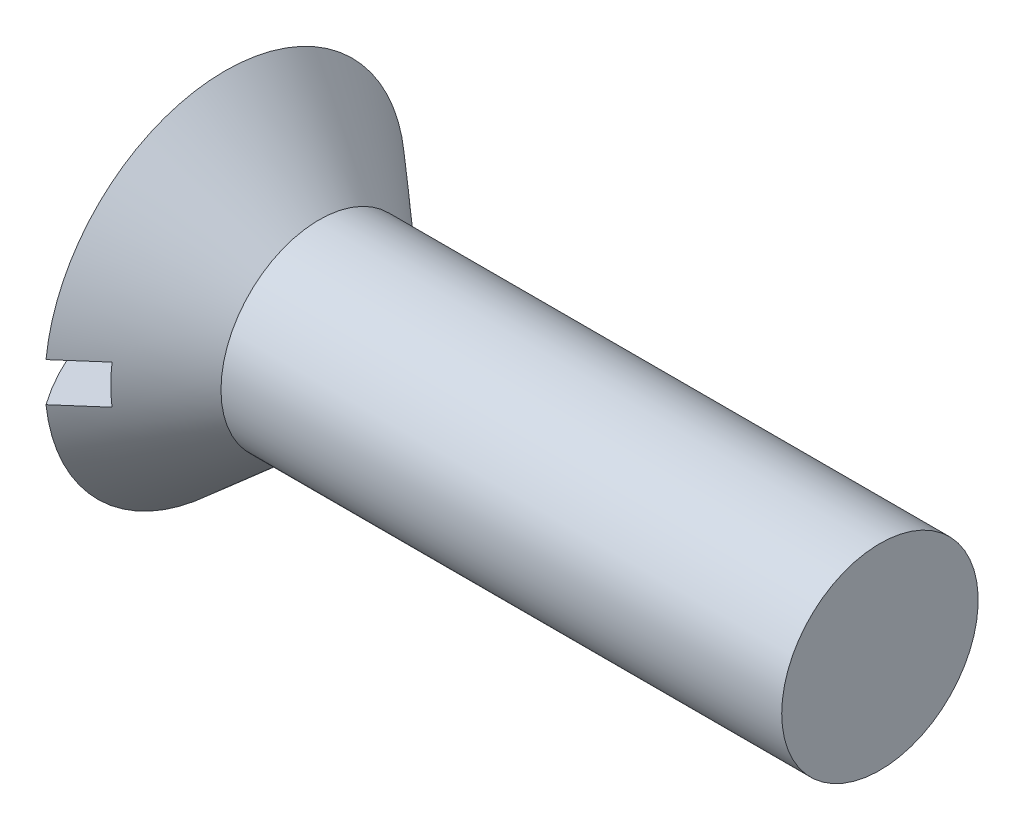
from build123d import *

# Parameters (mm, degrees)
SKETCH2_W         = 34.925
SKETCH2_H         = 3.7846
SLOT_DEPTH        = 8.9662
CIRPATTERN1_COUNT = 2
CIRPATTERN1_ANGLE = 90


with BuildPart() as part:
    # BodySke → Base-Revolve (revolve)
    with BuildSketch(Plane.XY):
        with BuildLine():
            Line((0, 0), (69.050150768, 0))
            Line((69.050150768, 0), (69.050150768, 9.525))
            Line((69.050150768, 9.525), (14.6812, 9.525))
            Line((14.6812, 9.525), (5.550150768, 17.4625))
            ThreePointArc((5.550150768, 17.4625), (1.420913597, 9.161646683), (0, 0))
        make_face()
    revolve(axis=Axis((-15.875, 0, 0), (1, 0, 0)))

    # Sketch2 → Slot (cut)
    with BuildSketch(Plane(origin=(0, 0, 0), x_dir=(0, 0, -1), z_dir=(1, 0, 0))):
        Rectangle(SKETCH2_W, SKETCH2_H)
    extrude(amount=SLOT_DEPTH, mode=Mode.SUBTRACT)

    # Sketch3 → Cross section 0
    with BuildSketch(Plane(origin=(0, 0, 0), x_dir=(0, 0, -1), z_dir=(1, 0, 0))):
        with BuildLine():
            Line((1.3208, -8.3312), (-1.3208, -8.3312))
            Line((-1.3208, -8.3312), (-1.3208, 8.3312))
            Line((-1.3208, 8.3312), (1.3208, 8.3312))
            Line((1.3208, 8.3312), (1.3208, -8.3312))
        make_face()
    # Sketch4 → Cross section 1
    with BuildSketch(Plane(origin=(10.16, 0, 0), x_dir=(0, 0, -1), z_dir=(1, 0, 0))):
        with BuildLine():
            Line((0.6604, -0.6604), (-0.6604, -0.6604))
            Line((-0.6604, -0.6604), (-0.6604, 0.6604))
            Line((-0.6604, 0.6604), (0.6604, 0.6604))
            Line((0.6604, 0.6604), (0.6604, -0.6604))
        make_face()
    cross = loft(mode=Mode.SUBTRACT)

    # CirPattern1: Cross ×2 about axis
    cirpattern1_axis = Axis((-15.875, 0, 0), (1, 0, 0))
    for i in range(1, CIRPATTERN1_COUNT):
        add(cross.rotate(cirpattern1_axis, i * CIRPATTERN1_ANGLE / (CIRPATTERN1_COUNT - 1)), mode=Mode.SUBTRACT)


solid = part.part
